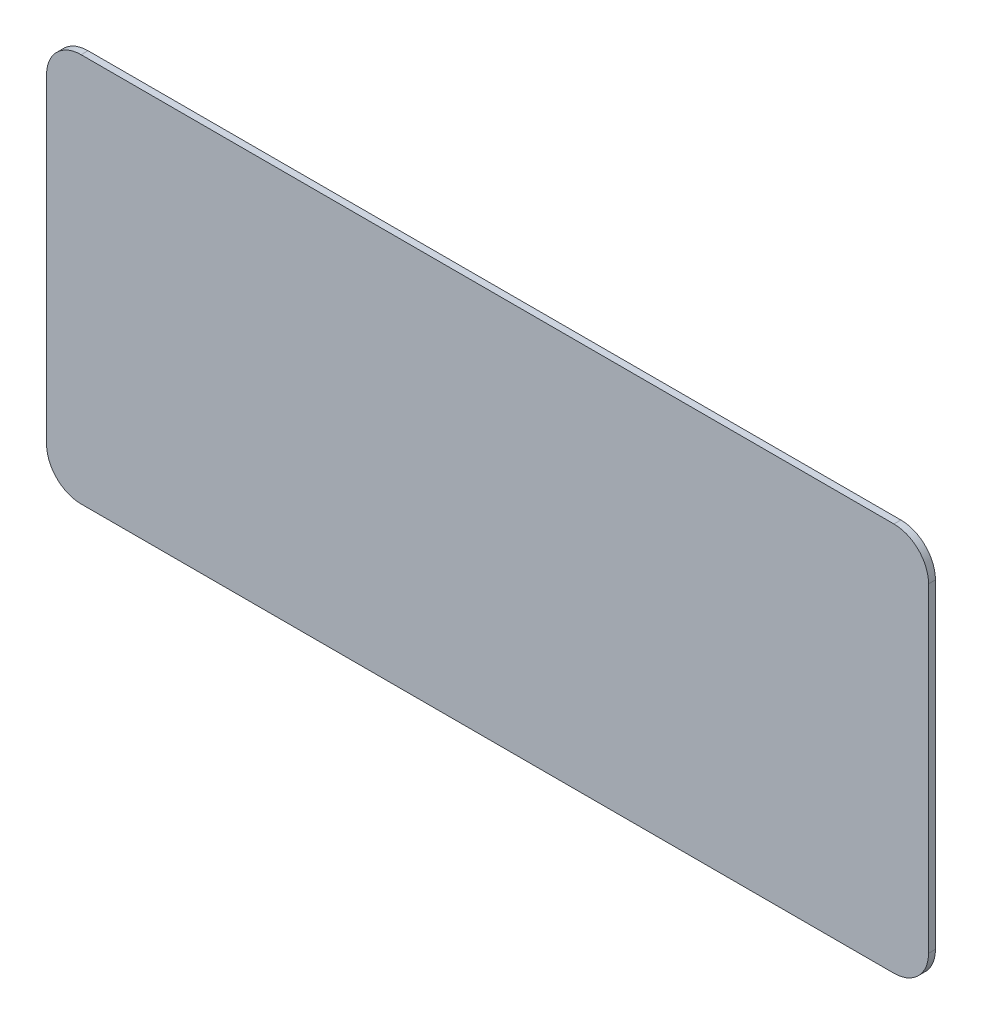
from build123d import *

# Parameters (mm, degrees)
SKETCH1_W           = 510
SKETCH1_H           = 225
BOSS_EXTRUDE1_DEPTH = 4
FILLET1_R           = 20


with BuildPart() as part:
    # Sketch1 → Boss-Extrude1 (new body)
    with BuildSketch(Plane.XY):
        Rectangle(SKETCH1_W, SKETCH1_H)
    extrude(amount=BOSS_EXTRUDE1_DEPTH)

    # Fillet1
    fillet1_edges = [part.edges().sort_by_distance(p)[0] for p in [
        (-255, -112.5, 2),
        (-255, 112.5, 2),
        (255, 112.5, 2),
        (255, -112.5, 2),
    ]]
    fillet(fillet1_edges, radius=FILLET1_R)


solid = part.part
